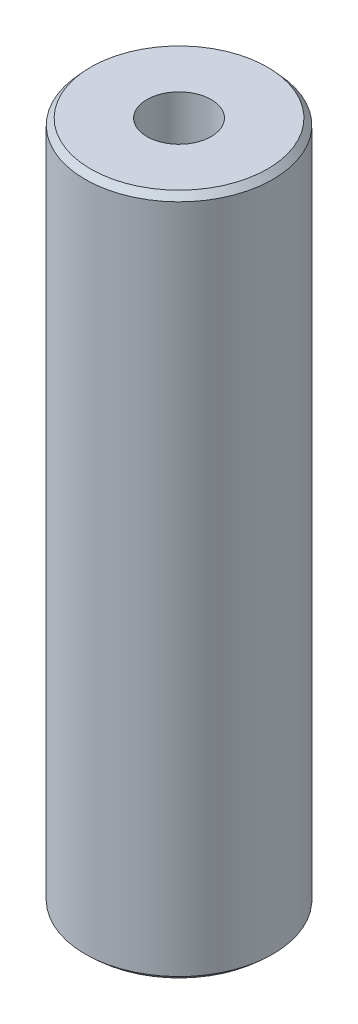
from build123d import *
from OCP.BRepFilletAPI import BRepFilletAPI_MakeChamfer

# Parameters (mm, degrees)
SKETCH1_R           = 45
BOSS_EXTRUDE1_DEPTH = 327.091430981
SKETCH2_R           = 15.399081828
CUT_EXTRUDE1_DEPTH  = 334.224855348
CHAMFER1_SIZE       = 2.947705939
CHAMFER1_SIZE2      = 2.671953604


with BuildPart() as part:
    # Sketch1 → Boss-Extrude1 (new body)
    with BuildSketch(Plane(origin=(0, 0, 0), x_dir=(1, 0, 0), z_dir=(0, 1, 0))):
        Circle(SKETCH1_R)
    extrude(amount=BOSS_EXTRUDE1_DEPTH)

    # Sketch2 → Cut-Extrude1 (cut, through all)
    with BuildSketch(Plane(origin=(0, 0, 0), x_dir=(1, 0, 0), z_dir=(0, 1, 0))):
        Circle(SKETCH2_R)
    extrude(amount=CUT_EXTRUDE1_DEPTH, mode=Mode.SUBTRACT)

    # Chamfer1: one chamfer whose edges measure the first distance from different faces: ONE call of the kernel's chamfer builder (chamfer() names one face for all edges)
    chamfer1_edges_1 = [part.edges().sort_by_distance(p)[0] for p in [
        (-45, 327.091430981, 0),
    ]]
    chamfer1_side_1 = [part.faces().sort_by_distance(p)[0] for p in [
        (-45, 163.545715491, 0),
    ]]
    chamfer1_edges_2 = [part.edges().sort_by_distance(p)[0] for p in [
        (-45, 0, 0),
    ]]
    chamfer1_side_2 = [part.faces().sort_by_distance(p)[0] for p in [
        (-43.727207794, 0, 0),
    ]]
    chamfer1 = BRepFilletAPI_MakeChamfer(part.part.solid().wrapped)
    for e in chamfer1_edges_1:
        chamfer1.Add(CHAMFER1_SIZE, CHAMFER1_SIZE2, e.wrapped, chamfer1_side_1[0].wrapped)  # the first distance lies on this face
    for e in chamfer1_edges_2:
        chamfer1.Add(CHAMFER1_SIZE, CHAMFER1_SIZE2, e.wrapped, chamfer1_side_2[0].wrapped)  # the first distance lies on this face
    add(Compound.cast(chamfer1.Shape()), mode=Mode.REPLACE)


solid = part.part
